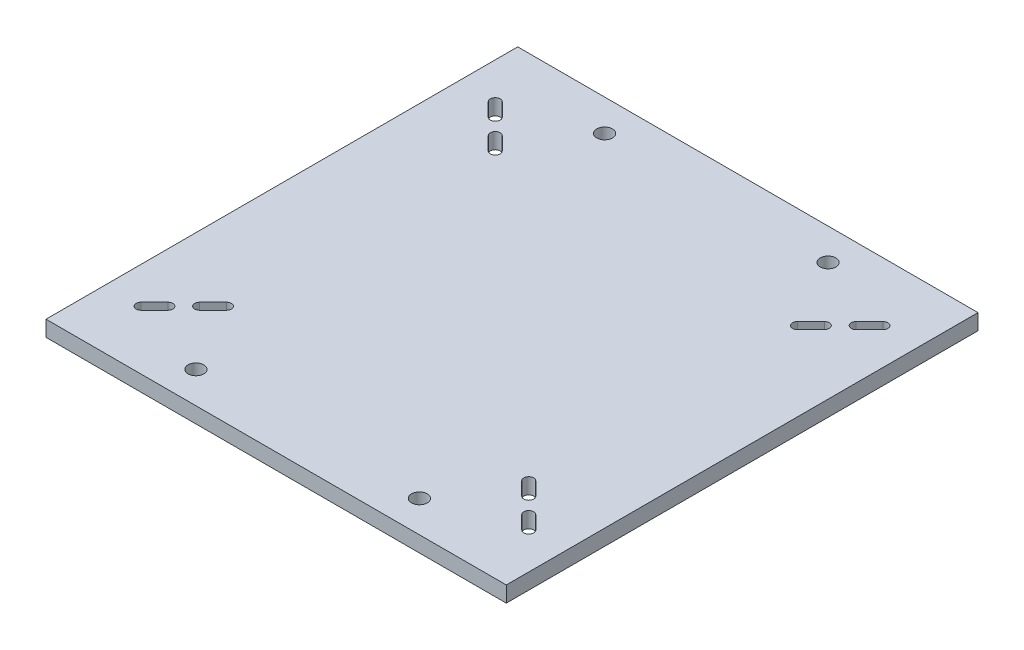
from build123d import *

# Parameters (mm, degrees)
SKETCH1_W              = 185.4
SKETCH1_H              = 190
BASE_PLATE_DEPTH       = 6.35
SLOTS_DEPTH            = 266.54374875
FEET_CONNECTION_HOLE_D = 6.35


with BuildPart() as part:
    # Sketch1 → base plate (new body)
    with BuildSketch(Plane(origin=(0, 0, 0), x_dir=(1, 0, 0), z_dir=(0, 1, 0))):
        with Locations((92.7, -95)):
            Rectangle(SKETCH1_W, SKETCH1_H)
    extrude(amount=-BASE_PLATE_DEPTH)

    # Sketch3 → slots (cut, through all)
    with BuildSketch(Plane(origin=(0, 0, 0), x_dir=(1, 0, 0), z_dir=(0, 1, 0))):
        with BuildLine():
            Line((18.59618524, -159.525387544), (13.208031568, -164.913541217))
            ThreePointArc((13.208031568, -164.913541217), (13.208031568, -167.741968432), (16.036458783, -167.741968432))
            Line((16.036458783, -167.741968432), (21.424612456, -162.35381476))
            ThreePointArc((21.424612456, -162.35381476), (21.424612456, -159.525387544), (18.59618524, -159.525387544))
        make_face()
        with BuildLine():
            Line((27.845142119, -155.933285096), (33.233295792, -150.545131423))
            ThreePointArc((33.233295792, -150.545131423), (33.233295792, -147.716704208), (30.404868577, -147.716704208))
            Line((30.404868577, -147.716704208), (25.016714904, -153.104857881))
            ThreePointArc((25.016714904, -153.104857881), (25.016714904, -155.933285096), (27.845142119, -155.933285096))
        make_face()
        with BuildLine():
            ThreePointArc((16.036458783, -22.258031568), (13.208031568, -22.258031568), (13.208031568, -25.086458783))
            Line((13.208031568, -25.086458783), (18.59618524, -30.474612456))
            ThreePointArc((18.59618524, -30.474612456), (21.424612456, -30.474612456), (21.424612456, -27.64618524))
            Line((21.424612456, -27.64618524), (16.036458783, -22.258031568))
        make_face()
        with BuildLine():
            ThreePointArc((30.404868577, -42.283295792), (33.233295792, -42.283295792), (33.233295792, -39.454868577))
            Line((33.233295792, -39.454868577), (27.845142119, -34.066714904))
            ThreePointArc((27.845142119, -34.066714904), (25.016714904, -34.066714904), (25.016714904, -36.895142119))
            Line((25.016714904, -36.895142119), (30.404868577, -42.283295792))
        make_face()
        with BuildLine():
            Line((166.80381476, -30.474612456), (172.191968432, -25.086458783))
            ThreePointArc((172.191968432, -25.086458783), (172.191968432, -22.258031568), (169.363541217, -22.258031568))
            Line((169.363541217, -22.258031568), (163.975387544, -27.64618524))
            ThreePointArc((163.975387544, -27.64618524), (163.975387544, -30.474612456), (166.80381476, -30.474612456))
        make_face()
        with BuildLine():
            Line((157.554857881, -34.066714904), (152.166704208, -39.454868577))
            ThreePointArc((152.166704208, -39.454868577), (152.166704208, -42.283295792), (154.995131423, -42.283295792))
            Line((154.995131423, -42.283295792), (160.383285096, -36.895142119))
            ThreePointArc((160.383285096, -36.895142119), (160.383285096, -34.066714904), (157.554857881, -34.066714904))
        make_face()
        with BuildLine():
            ThreePointArc((154.995131423, -147.716704208), (152.166704208, -147.716704208), (152.166704208, -150.545131423))
            Line((152.166704208, -150.545131423), (157.554857881, -155.933285096))
            ThreePointArc((157.554857881, -155.933285096), (160.383285096, -155.933285096), (160.383285096, -153.104857881))
            Line((160.383285096, -153.104857881), (154.995131423, -147.716704208))
        make_face()
        with BuildLine():
            ThreePointArc((169.363541217, -167.741968432), (172.191968432, -167.741968432), (172.191968432, -164.913541217))
            Line((172.191968432, -164.913541217), (166.80381476, -159.525387544))
            ThreePointArc((166.80381476, -159.525387544), (163.975387544, -159.525387544), (163.975387544, -162.35381476))
            Line((163.975387544, -162.35381476), (169.363541217, -167.741968432))
        make_face()
    extrude(amount=-SLOTS_DEPTH, mode=Mode.SUBTRACT)

    # Feet connection hole (through all)
    with Locations(Plane(origin=(0, 0, 0), x_dir=(1, 0, 0), z_dir=(0, 1, 0))):
        with Locations((47.7, -177.3), (137.7, -12.7), (47.7, -12.7), (137.7, -177.3)):
            Hole(FEET_CONNECTION_HOLE_D / 2)


solid = part.part
